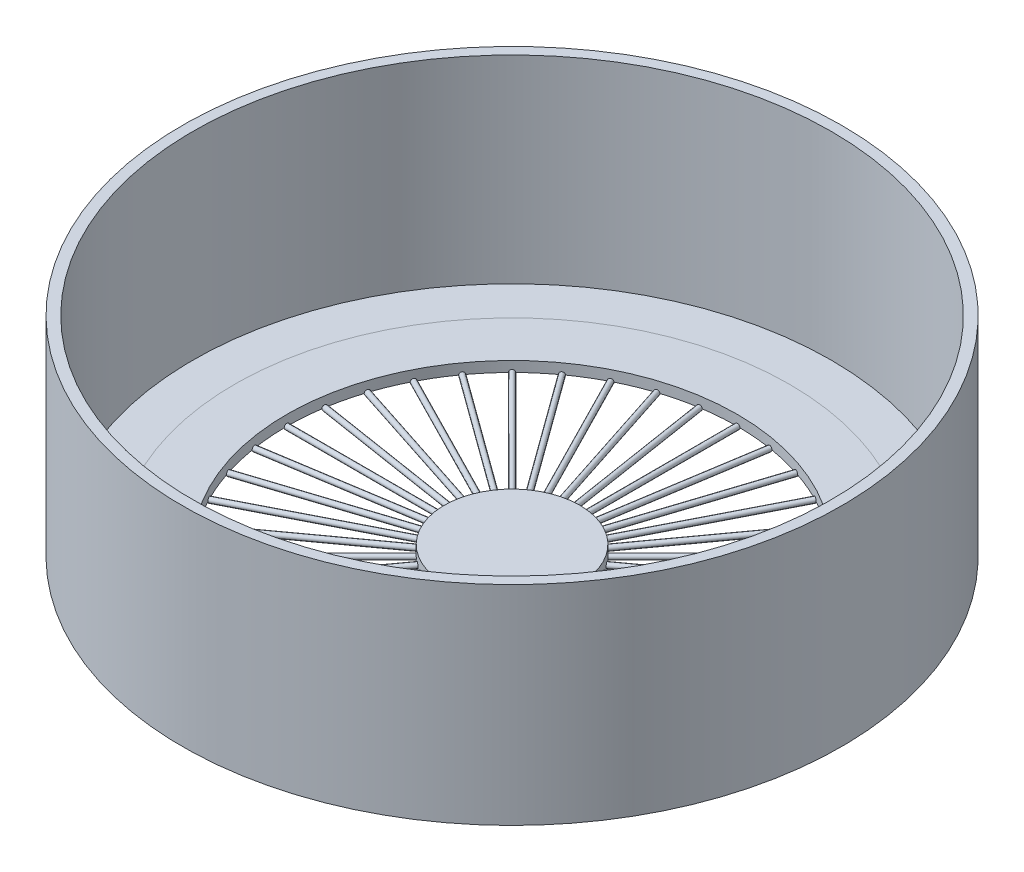
from build123d import *

# Parameters (mm, degrees)
SWEEP1_PROFILE_R    = 2.5
CIRPATTERN1_COUNT   = 40
SKETCH46_R          = 65
BOSS_EXTRUDE1_DEPTH = 10
BOSS_EXTRUDE2_START = 10
SKETCH47_R          = 65
BOSS_EXTRUDE2_DEPTH = 10
ECHELLE1_SCALE      = 0.47


with BuildPart() as part:
    # Sketch1 → Revolve1 (revolve)
    with BuildSketch(Plane.XY, mode=Mode.PRIVATE) as revolve1_sk:
        Polygon((266.000015316, 0), (316, 0.039136187), (316, 200.039136187), (306, 200.039136187), (306, 10.031312011), (265.996101697, 10), (216.000015316, 10), (216.000015316, 0), align=None)
    revolve(revolve1_sk.sketch.rotate(Axis((0, 0, 0), (0, 1, 0)), 90), axis=Axis((0, 0, 0), (0, 1, 0)))

    # Sweep1: sweep along a path in Sketch2
    with BuildLine(Plane(origin=(0, 0, 0), x_dir=(-1, 0, 0), z_dir=(0, -1, 0))) as sweep1_path:
        Line((0, -216.000015316), (0, 216.000015316))
    # Sweep1 profile (on start of the path) → Sweep1 (sweep)
    with BuildSketch(Plane(origin=(0, 0, 216.000015316), x_dir=(-1, 0, 0), z_dir=(0, 0, -1))):
        Circle(SWEEP1_PROFILE_R)
    sweep1 = sweep(path=sweep1_path.line)

    # CirPattern1: Sweep1 ×40 about axis
    cirpattern1_axis = Axis((0, 0, 0), (0, 1, 0))
    for i in range(1, CIRPATTERN1_COUNT):
        add(sweep1.rotate(cirpattern1_axis, i * 360 / CIRPATTERN1_COUNT))

    # Sketch46 → Boss-Extrude1 (add)
    with BuildSketch(Plane.XZ):
        with Locations(Location((0, 0, 0), (0, 0, 270))):
            Circle(SKETCH46_R)
    extrude(amount=-BOSS_EXTRUDE1_DEPTH)

    # Sketch47 → Boss-Extrude2 (add)
    with BuildSketch(Plane.XZ.offset(BOSS_EXTRUDE2_START)):
        with Locations(Location((0, 0, 0), (0, 0, 270))):
            Circle(SKETCH47_R)
    extrude(amount=-BOSS_EXTRUDE2_DEPTH)


with BuildPart() as part_1:
    # Echelle1: scaled about (-1.685e-06, 69.060991769, 3.247e-06)
    add(part.part.scale(ECHELLE1_SCALE).moved(Location((-8.93e-07, 36.602325638, 1.721e-06))))


solid = part_1.part
